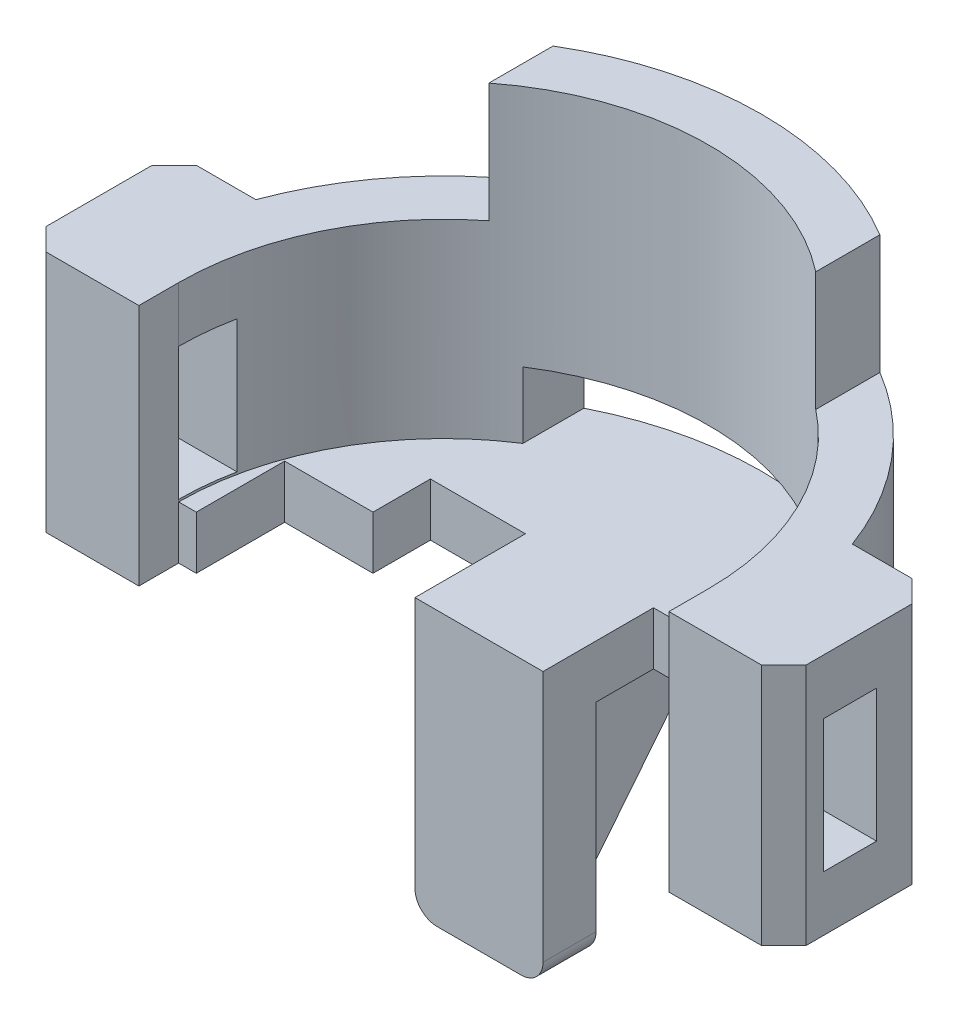
from build123d import *

# Parameters (mm, degrees)
SKETCH1_W                = 6
SKETCH1_H                = 1.2
SKETCH1_W_2              = 1.2
SKETCH1_H_2              = 4.3
REVOLVE1_ANGLE           = 180
REVOLVE2_START           = 4.3
REVOLVE2_DEPTH           = 2.7
SKETCH3_W                = 6.5
SKETCH3_H                = 1.5
CUT_EXTRUDE1_DEPTH       = 10
CUT_EXTRUDE2_DEPTH       = 10
SKETCH7_W                = 2.9
SKETCH7_H                = 1.2
BOSS_EXTRUDE3_DEPTH      = 5
BOSS_EXTRUDE4_DEPTH      = 0.6
FILLET1_R                = 0.5
SKETCH9_W                = 3.4
SKETCH9_H                = 5.5
SKETCH9_W_2              = 1.2
SKETCH9_H_2              = 3
BOSS_EXTRUDE5_DEPTH      = 2.6
SKETCH11_W               = 1.2
SKETCH11_H               = 3
CUT_EXTRUDE3_DEPTH       = 3.6
CHAMFER2_SIZE            = 0.5
CHAMFER3_SIZE            = 0.5
CHAMFER2_OF_MIRROR2_SIZE = 0.5
CHAMFER3_OF_MIRROR2_SIZE = 0.5
SKETCH5_W                = 2
SKETCH5_H                = 2
CUT_EXTRUDE4_DEPTH       = 3.6


# Read off the part's stored shape, not the designer's step: Revolve2
with BuildPart() as part:
    # Sketch1 → Revolve1 (revolve)
    with BuildSketch(Plane.XY):
        with Locations((3, -0.6)):
            Rectangle(SKETCH1_W, SKETCH1_H)
        with Locations((6.6, -0.6)):
            Rectangle(SKETCH1_W_2, SKETCH1_H)
        with Locations((6.6, 2.15)):
            Rectangle(SKETCH1_W_2, SKETCH1_H_2)
    revolve(axis=Axis((0, -1.2, 0), (0, 1, 0)), revolution_arc=REVOLVE1_ANGLE)

    # Revolve2 outline → Revolve2 (add)
    with BuildSketch(Plane(origin=(0, 0, 0), x_dir=(1, 0, 0), z_dir=(0, 1, 0)).offset(REVOLVE2_START)):
        with BuildLine():
            ThreePointArc((3.7, 6.176568627), (0, 7.2), (-3.7, 6.176568627))
            Line((-3.7, 6.176568627), (-3.7, 4.723346271))
            ThreePointArc((-3.7, 4.723346271), (0, 6), (3.7, 4.723346271))
            Line((3.7, 4.723346271), (3.7, 6.176568627))
        make_face()
    extrude(amount=REVOLVE2_DEPTH)

    # Sketch3 → Cut-Extrude1 (cut)
    with BuildSketch(Plane.XY):
        with Locations((0, 0.75)):
            Rectangle(SKETCH3_W, SKETCH3_H)
    extrude(amount=-CUT_EXTRUDE1_DEPTH, mode=Mode.SUBTRACT)

    # Sketch4 → Cut-Extrude2 (cut)
    with BuildSketch(Plane(origin=(0, 0, 0), x_dir=(1, 0, 0), z_dir=(0, 1, 0))):
        Polygon((-1.45, 3.3), (-3.6, 3.3), (-3.6, 0), (3.6, 0), (3.6, 3.3), (1.45, 3.3), (1.45, 0.8), (-1.45, 0.8), align=None)
    extrude(amount=-CUT_EXTRUDE2_DEPTH, mode=Mode.SUBTRACT)

    # Sketch7 → Boss-Extrude3 (add)
    with BuildSketch(Plane.XZ.offset(1.2)):
        with Locations((0, -1.4)):
            Rectangle(SKETCH7_W, SKETCH7_H)
    extrude(amount=BOSS_EXTRUDE3_DEPTH)

    # Sketch8 → Boss-Extrude4 (add, symmetric)
    with BuildSketch(Plane(origin=(0, 0, 0), x_dir=(0, 0, -1), z_dir=(1, 0, 0))):
        Polygon((2, -6.2), (6, -1.2), (2, -1.2), align=None)
    extrude(amount=BOSS_EXTRUDE4_DEPTH, both=True)

    # Fillet1
    fillet1_edges = [part.edges().sort_by_distance(p)[0] for p in [
        (-1.45, -6.2, -1.4),
        (1.45, -6.2, -1.4),
    ]]
    fillet(fillet1_edges, radius=FILLET1_R)

    # Sketch9 → Boss-Extrude5 (add)
    with BuildSketch(Plane(origin=(6, 0, 0), x_dir=(0, 0, -1), z_dir=(1, 0, 0))):
        with Locations((0.8, 1.55)):
            Rectangle(SKETCH9_W, SKETCH9_H)
        with Locations((0.6, 1.55)):
            Rectangle(SKETCH9_W_2, SKETCH9_H_2, mode=Mode.SUBTRACT)
    boss_extrude5 = extrude(amount=BOSS_EXTRUDE5_DEPTH)

    # Sketch11 → Cut-Extrude3 (cut)
    with BuildSketch(Plane(origin=(8.6, 0, 0), x_dir=(0, 0, -1), z_dir=(1, 0, 0))):
        with Locations((0.6, 1.55)):
            Rectangle(SKETCH11_W, SKETCH11_H)
    cut_extrude3 = extrude(amount=-CUT_EXTRUDE3_DEPTH, mode=Mode.SUBTRACT)

    # Chamfer2
    chamfer2_edges = [part.edges().sort_by_distance(p)[0] for p in [
        (8.6, 1.55, 0.9),
    ]]
    chamfer(chamfer2_edges, length=CHAMFER2_SIZE)

    # Chamfer3
    chamfer3_edges = [part.edges().sort_by_distance(p)[0] for p in [
        (8.6, 1.55, -2.5),
    ]]
    chamfer(chamfer3_edges, length=CHAMFER3_SIZE)

    # Mirror2: Boss-Extrude5, Cut-Extrude3 across plane
    add(boss_extrude5.mirror(Plane(origin=(0, 0, 0), x_dir=(0, 0, 1), z_dir=(1, 0, 0))))
    add(cut_extrude3.mirror(Plane(origin=(0, 0, 0), x_dir=(0, 0, 1), z_dir=(1, 0, 0))), mode=Mode.SUBTRACT)

    # Chamfer2 of Mirror2
    chamfer2_of_mirror2_edges = [part.edges().sort_by_distance(p)[0] for p in [
        (-8.6, 1.55, 0.9),
    ]]
    chamfer(chamfer2_of_mirror2_edges, length=CHAMFER2_OF_MIRROR2_SIZE)

    # Chamfer3 of Mirror2
    chamfer3_of_mirror2_edges = [part.edges().sort_by_distance(p)[0] for p in [
        (-8.6, 1.55, -2.5),
    ]]
    chamfer(chamfer3_of_mirror2_edges, length=CHAMFER3_OF_MIRROR2_SIZE)

    # Sketch5 → Cut-Extrude4 (cut)
    with BuildSketch(Plane(origin=(0, 0, 0), x_dir=(1, 0, 0), z_dir=(0, 1, 0))):
        with Locations((4.6, 1)):
            Rectangle(SKETCH5_W, SKETCH5_H)
        with Locations((-4.6, 1)):
            Rectangle(SKETCH5_W, SKETCH5_H)
    extrude(amount=-CUT_EXTRUDE4_DEPTH, mode=Mode.SUBTRACT)


solid = part.part
